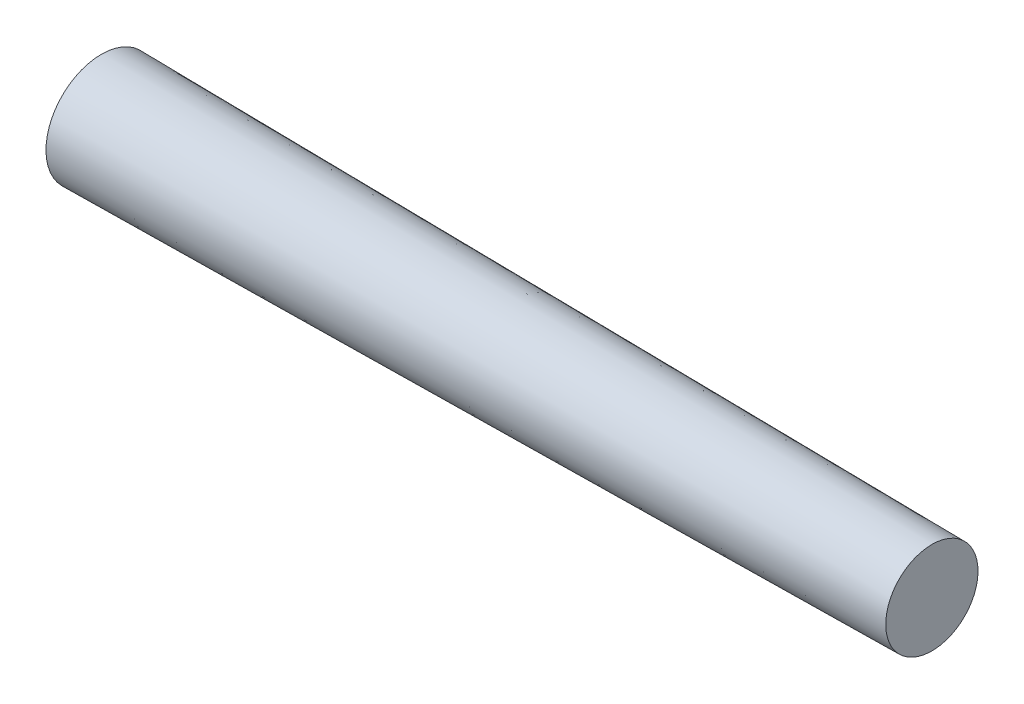
from build123d import *

# Parameters (mm, degrees)
REVOLVE1_ANGLE = 359.999695921


with BuildPart() as part:
    # Sketch1 → Revolve1 (revolve)
    with BuildSketch(Plane.XY):
        Polygon((0, 0), (0, 3), (45, 2.5), (45, 0), align=None)
    revolve(axis=Axis((0, 0, 0), (1, 0, 0)), revolution_arc=REVOLVE1_ANGLE)


solid = part.part
